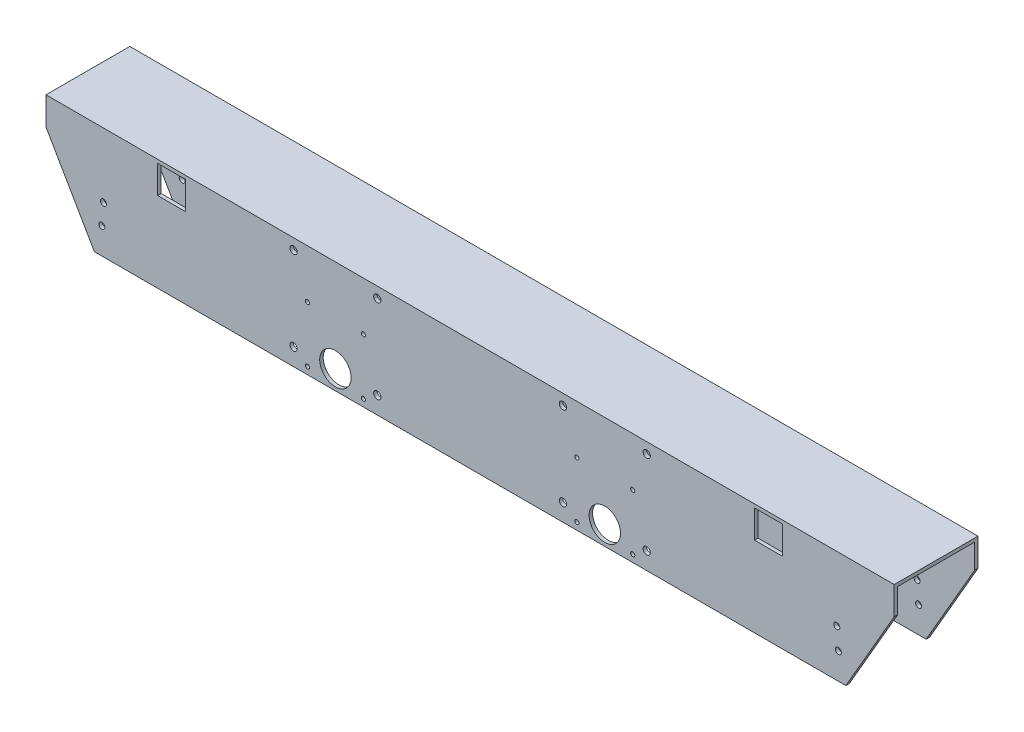
from build123d import *

# Parameters (mm, degrees)
BOSS_EXTRUDE1_DEPTH   = 385.705756272
SKETCH2_R             = 2.749999961
SKETCH2_R_2           = 14.2875
SKETCH2_R_3           = 2.75
CUT_EXTRUDE1_DEPTH    = 141.732
SKETCH14_R            = 3.302
CUT_EXTRUDE12_DEPTH   = 397.429073633
CUT_EXTRUDE13_DEPTH   = 101.6
F_6_CLEARANCE_HOLE1_D = 3.7973
CUT_EXTRUDE20_REACH   = 398.429
SKETCH25_W            = 25.4
SKETCH25_H            = 25.4
F_6_CLEARANCE_HOLE2_D = 3.7973


with BuildPart() as part:
    # Sketch1 → Boss-Extrude1 (new, symmetric)
    with BuildSketch(Plane(origin=(0, 0, 0), x_dir=(0, 0, -1), z_dir=(1, 0, 0))):
        Polygon((-38.1, 50.8), (38.1, 50.8), (38.1, -50.8), (34.925, -50.8), (34.925, 47.625), (-34.925, 47.625), (-34.925, -50.8), (-38.1, -50.8), align=None)
    extrude(amount=BOSS_EXTRUDE1_DEPTH, both=True)

    # Sketch2 → Cut-Extrude1 (cut)
    with BuildSketch(Plane.XY.offset(38.1)):
        with Locations((-333.475837626, -7.9375)):
            Circle(SKETCH2_R)
        with Locations((122.50039, -33.3375)):
            Circle(SKETCH2_R_2)
        with Locations((333.475837626, -7.9375)):
            Circle(SKETCH2_R)
        with Locations((334.902632555, -26.927596819)):
            Circle(SKETCH2_R_3)
        with Locations((-122.50039, -33.3375)):
            Circle(SKETCH2_R_2)
        with Locations((-334.902632555, -26.927596819)):
            Circle(SKETCH2_R_3)
    extrude(amount=-CUT_EXTRUDE1_DEPTH, mode=Mode.SUBTRACT)

    # Sketch14 → Cut-Extrude12 (cut, through all)
    with BuildSketch(Plane(origin=(0, 0, -38.1), x_dir=(-1, 0, 0), z_dir=(0, 0, -1))):
        with Locations((-160.60039, -35.123476108)):
            Circle(SKETCH14_R)
        with Locations((-160.61182, 41.076523035)):
            Circle(SKETCH14_R)
        with Locations((-84.41182, 41.076523892)):
            Circle(SKETCH14_R)
        with Locations((-84.41182, -35.123476108)):
            Circle(SKETCH14_R)
        with Locations((160.60039, -35.123476108)):
            Circle(SKETCH14_R)
        with Locations((84.41182, -35.123476108)):
            Circle(SKETCH14_R)
        with Locations((84.41182, 41.076523892)):
            Circle(SKETCH14_R)
        with Locations((160.61182, 41.076523035)):
            Circle(SKETCH14_R)
    extrude(amount=-CUT_EXTRUDE12_DEPTH, mode=Mode.SUBTRACT)

    # Sketch16 → Cut-Extrude13 (cut)
    with BuildSketch(Plane.XY.offset(38.1)):
        Polygon((-385.705756272, 25.4), (-341.71166576, -50.8), (-385.705756272, -50.8), align=None)
        Polygon((341.71166576, -50.8), (385.705756272, -50.8), (385.705756272, 25.4), align=None)
    extrude(amount=-CUT_EXTRUDE13_DEPTH, mode=Mode.SUBTRACT)

    # #6 Clearance Hole1 (through all)
    with Locations(Plane.XY.offset(38.1)):
        with Locations((-147.90039, -44.3), (-97.10039, -44.3), (97.10039, -44.3), (147.90039, -44.3), (-147.90039, 6.5), (-97.10039, 6.5), (97.10039, 6.5), (147.90039, 6.5)):
            Hole(F_6_CLEARANCE_HOLE1_D / 2)

    # Sketch25 → Cut-Extrude20 (cut, up to next)
    with BuildSketch(Plane.XY.offset(38.1), mode=Mode.PRIVATE) as cut_extrude20_sk1:
        with Locations((271.405756272, 34.925)):
            Rectangle(SKETCH25_W, SKETCH25_H)
    cut_extrude20_tool1 = extrude(cut_extrude20_sk1.sketch, amount=-CUT_EXTRUDE20_REACH, mode=Mode.PRIVATE) & part.part
    # Sketch25 → Cut-Extrude20 (cut, up to next)
    with BuildSketch(Plane.XY.offset(38.1), mode=Mode.PRIVATE) as cut_extrude20_sk2:
        with Locations((-271.405756272, 34.925)):
            Rectangle(SKETCH25_W, SKETCH25_H)
    cut_extrude20_tool2 = extrude(cut_extrude20_sk2.sketch, amount=-CUT_EXTRUDE20_REACH, mode=Mode.PRIVATE) & part.part
    add(cut_extrude20_tool1.solids().sort_by_distance((271.405756, 34.925, 38.1))[0], mode=Mode.SUBTRACT)
    add(cut_extrude20_tool2.solids().sort_by_distance((-271.405756, 34.925, 38.1))[0], mode=Mode.SUBTRACT)

    # #6 Clearance Hole2 (through all)
    with Locations(Plane.XY.offset(-34.925)):
        with Locations((-271.405756272, 34.925), (271.405756272, 34.925)):
            Hole(F_6_CLEARANCE_HOLE2_D / 2)


solid = part.part
